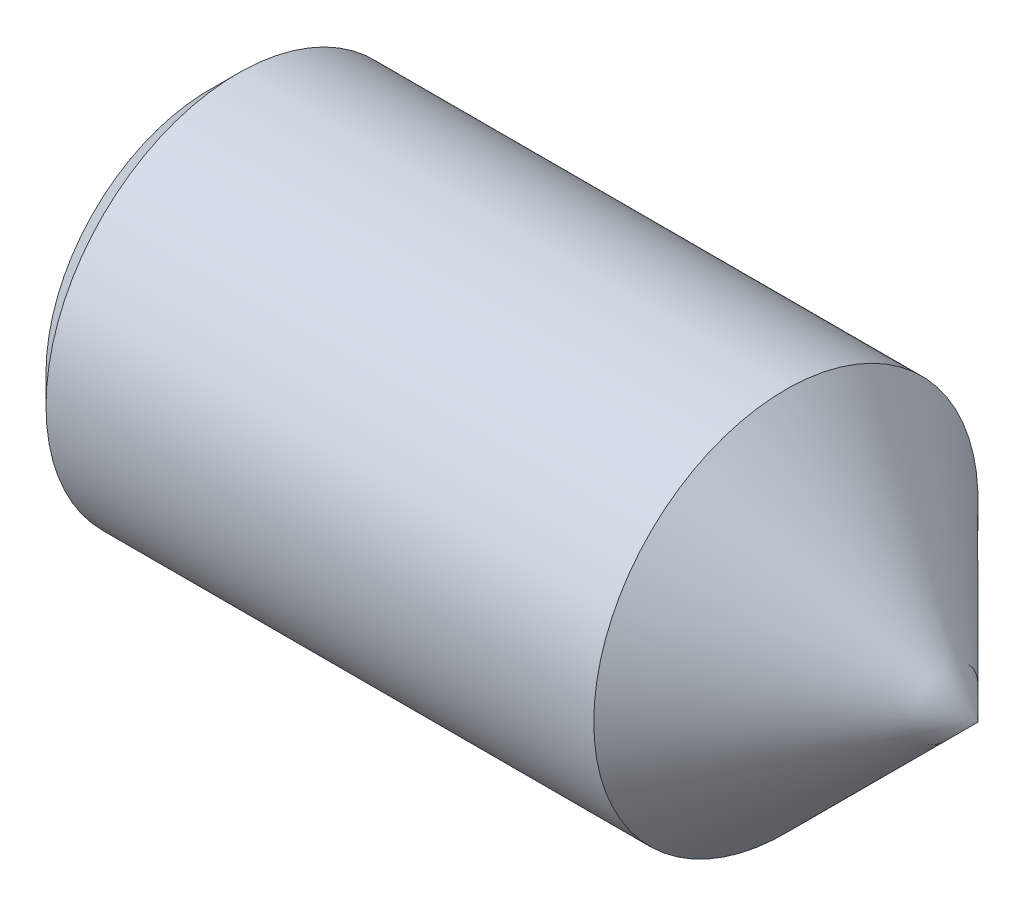
from build123d import *

# Parameters (mm, degrees)
HEX_2_DEPTH = 14.2748


with BuildPart() as part:
    # BodySke → BaseBody (revolve)
    with BuildSketch(Plane.XY):
        Polygon((0, 0), (0, 10.81024), (1.88976, 12.7), (38.1, 12.7), (50.8, 0), align=None)
    revolve(axis=Axis((-12.7, 0, 0), (1, 0, 0)))

    # Sketch2 → Hex 2 (cut)
    with BuildSketch(Plane.ZY):
        Polygon((4.120779811, 7.1374), (-4.120779811, 7.1374), (-8.241559623, 0), (-4.120779811, -7.1374), (4.120779811, -7.1374), (8.241559623, 0), align=None)
    extrude(amount=-HEX_2_DEPTH, mode=Mode.SUBTRACT)


solid = part.part
